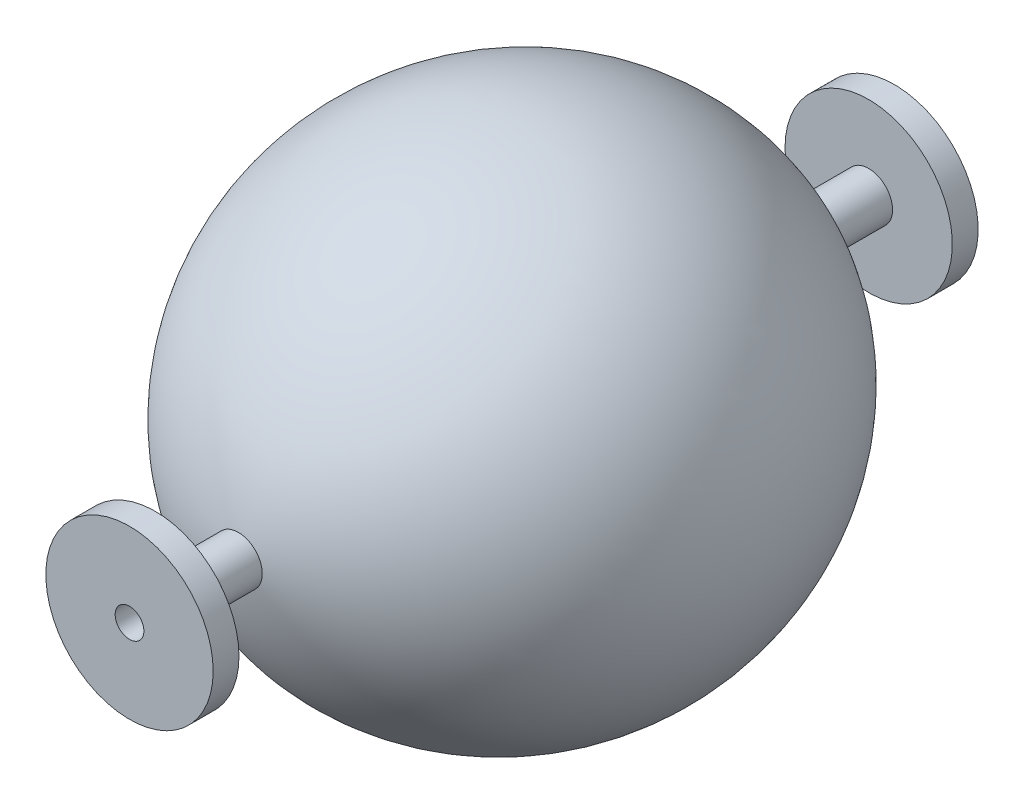
from build123d import *

# Parameters (mm, degrees)
BOSS_EXTRUDE1_REACH = 80.186
SKETCH3_R           = 2.5
BOSS_EXTRUDE2_REACH = 90.045
SKETCH4_R           = 2.5
SKETCH5_R           = 8.75
BOSS_EXTRUDE3_DEPTH = 2.7
BOSS_EXTRUDE4_START = -2.7
SKETCH6_R           = 8.75
BOSS_EXTRUDE4_DEPTH = 2.7
CUT_EXTRUDE1_REACH  = 90.045
SKETCH7_R           = 1.5


# Read off the part's stored shape, not the designer's step: Shell2
with BuildPart() as part:
    # Sketch1 → Revolve1 (revolve)
    with BuildSketch(Plane(origin=(0, 0, 0), x_dir=(1, 0, 0), z_dir=(0, 1, 0))):
        with BuildLine():
            Line((0, 29), (0, -29))
            ThreePointArc((0, -29), (-26, 0), (0, 29))
        make_face()
    revolve(axis=Axis((0, 0, -29), (0, 0, 1)))

    # Sketch3 → Boss-Extrude1 (add, up to next)
    with BuildSketch(Plane.XY.offset(40), mode=Mode.PRIVATE) as boss_extrude1_sk1:
        Circle(SKETCH3_R)
    boss_extrude1_tool1 = extrude(boss_extrude1_sk1.sketch, amount=-BOSS_EXTRUDE1_REACH, mode=Mode.PRIVATE) - part.part
    add(boss_extrude1_tool1.solids().sort_by_distance((0, 0, 40))[0])

    # Sketch4 → Boss-Extrude2 (add, up to next)
    with BuildSketch(Plane.XY.offset(-40), mode=Mode.PRIVATE) as boss_extrude2_sk1:
        Circle(SKETCH4_R)
    boss_extrude2_tool1 = extrude(boss_extrude2_sk1.sketch, amount=BOSS_EXTRUDE2_REACH, mode=Mode.PRIVATE) - part.part
    add(boss_extrude2_tool1.solids().sort_by_distance((0, 0, -40))[0])

    # Shell2 outline → Shell2 (revolve, cut)
    with BuildSketch(Plane.XZ):
        with BuildLine():
            Line((1, 27.356619224), (1, 40))
            Line((1, 40), (0, 40))
            Line((0, 40), (0, -38.5))
            Line((0, -38.5), (1, -38.5))
            Line((1, -38.5), (1, -27.356619224))
            ThreePointArc((1, -27.356619224), (24.5, 0), (1, 27.356619224))
        make_face()
    revolve(axis=Axis((0, 0, 0), (0, 0, 1)), mode=Mode.SUBTRACT)

    # Sketch5 → Boss-Extrude3 (add)
    with BuildSketch(Plane.XY.offset(40)):
        Circle(SKETCH5_R)
    extrude(amount=-BOSS_EXTRUDE3_DEPTH)

    # Sketch6 → Boss-Extrude4 (add)
    with BuildSketch(Plane(origin=(0, 0, -40), x_dir=(-1, 0, 0), z_dir=(0, 0, -1)).offset(BOSS_EXTRUDE4_START)):
        with Locations(Location((0, 0, 0), (0, 0, 180))):
            Circle(SKETCH6_R)
    extrude(amount=BOSS_EXTRUDE4_DEPTH)

    # Sketch7 → Cut-Extrude1 (cut, up to next)
    with BuildSketch(Plane.XY.offset(40), mode=Mode.PRIVATE) as cut_extrude1_sk1:
        Circle(SKETCH7_R)
    cut_extrude1_tool1 = extrude(cut_extrude1_sk1.sketch, amount=-CUT_EXTRUDE1_REACH, mode=Mode.PRIVATE) & part.part
    add(cut_extrude1_tool1.solids().sort_by_distance((0, 0, 40))[0], mode=Mode.SUBTRACT)


solid = part.part
